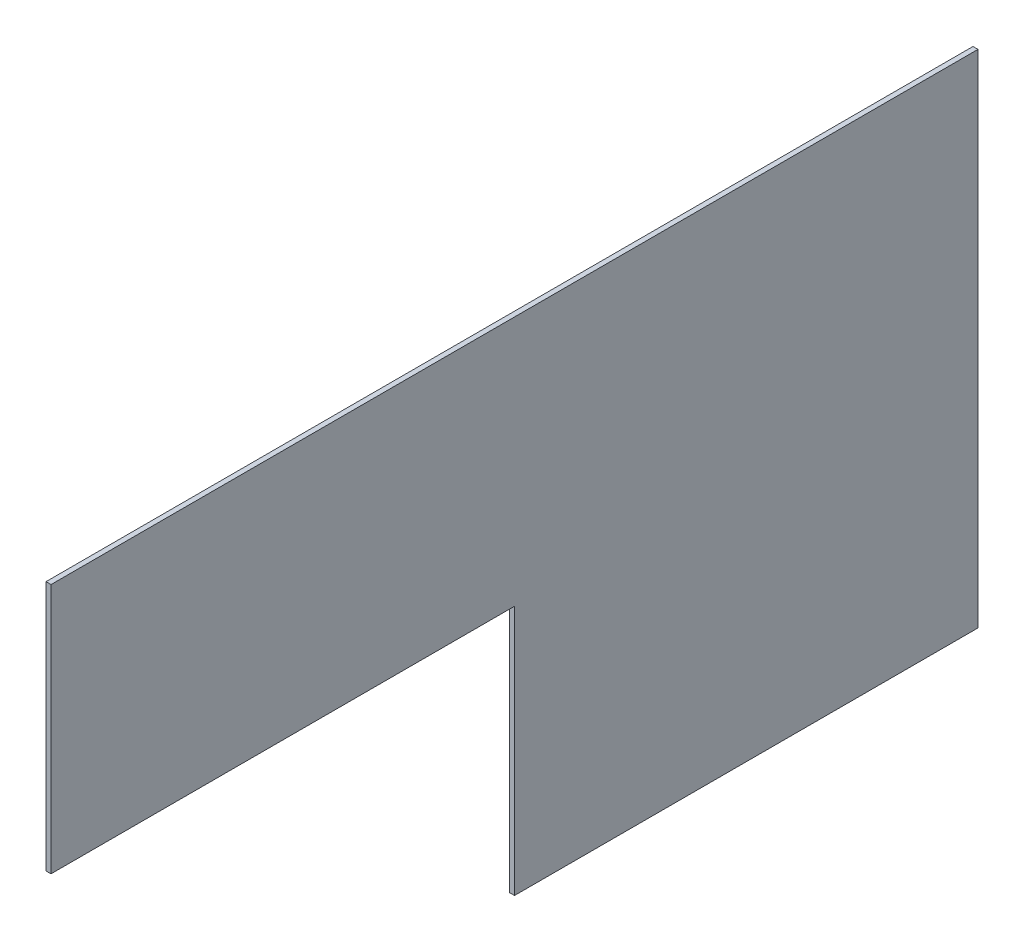
from build123d import *

# Parameters (mm, degrees)
BASE_FLANGE1_DEPTH = 2


# Sheet-metal steps are written as plain solids
with BuildPart() as part:
    # Sketch1 → Base-Flange1 (new body)
    with BuildSketch(Plane(origin=(0, 0, 0), x_dir=(0, 0, -1), z_dir=(1, 0, 0))):
        Polygon((0, 0), (0, -100), (185, -100), (185, -200), (370, -200), (370, 0), align=None)
    extrude(amount=-BASE_FLANGE1_DEPTH)


solid = part.part
